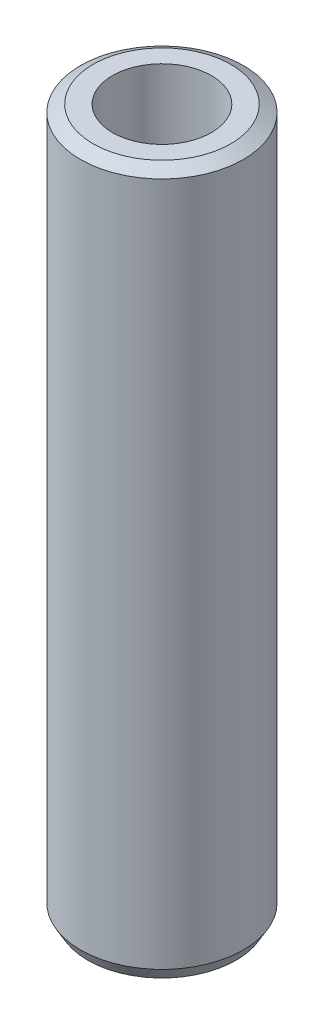
from build123d import *
from OCP.BRepFilletAPI import BRepFilletAPI_MakeChamfer

# Parameters (mm, degrees)
SKETCH1_R           = 20
BOSS_EXTRUDE1_DEPTH = 172.985438553
SKETCH2_R           = 12.141009963
CUT_EXTRUDE1_DEPTH  = 176.282520382
CHAMFER1_SIZE       = 1.788350472
CHAMFER1_SIZE2      = 3.097513879


with BuildPart() as part:
    # Sketch1 → Boss-Extrude1 (new body)
    with BuildSketch(Plane(origin=(0, 0, 0), x_dir=(1, 0, 0), z_dir=(0, 1, 0))):
        Circle(SKETCH1_R)
    extrude(amount=BOSS_EXTRUDE1_DEPTH)

    # Sketch2 → Cut-Extrude1 (cut, through all)
    with BuildSketch(Plane(origin=(0, 0, 0), x_dir=(1, 0, 0), z_dir=(0, 1, 0))):
        Circle(SKETCH2_R)
    extrude(amount=CUT_EXTRUDE1_DEPTH, mode=Mode.SUBTRACT)

    # Chamfer1: one chamfer whose edges measure the first distance from different faces: ONE call of the kernel's chamfer builder (chamfer() names one face for all edges)
    chamfer1_edges_1 = [part.edges().sort_by_distance(p)[0] for p in [
        (-20, 172.985438553, 0),
    ]]
    chamfer1_side_1 = [part.faces().sort_by_distance(p)[0] for p in [
        (-20, 86.492719277, 0),
    ]]
    chamfer1_edges_2 = [part.edges().sort_by_distance(p)[0] for p in [
        (-20, 0, 0),
    ]]
    chamfer1_side_2 = [part.faces().sort_by_distance(p)[0] for p in [
        (-19.434314575, 0, 0),
    ]]
    chamfer1 = BRepFilletAPI_MakeChamfer(part.part.solid().wrapped)
    for e in chamfer1_edges_1:
        chamfer1.Add(CHAMFER1_SIZE, CHAMFER1_SIZE2, e.wrapped, chamfer1_side_1[0].wrapped)  # the first distance lies on this face
    for e in chamfer1_edges_2:
        chamfer1.Add(CHAMFER1_SIZE, CHAMFER1_SIZE2, e.wrapped, chamfer1_side_2[0].wrapped)  # the first distance lies on this face
    add(Compound.cast(chamfer1.Shape()), mode=Mode.REPLACE)


solid = part.part
